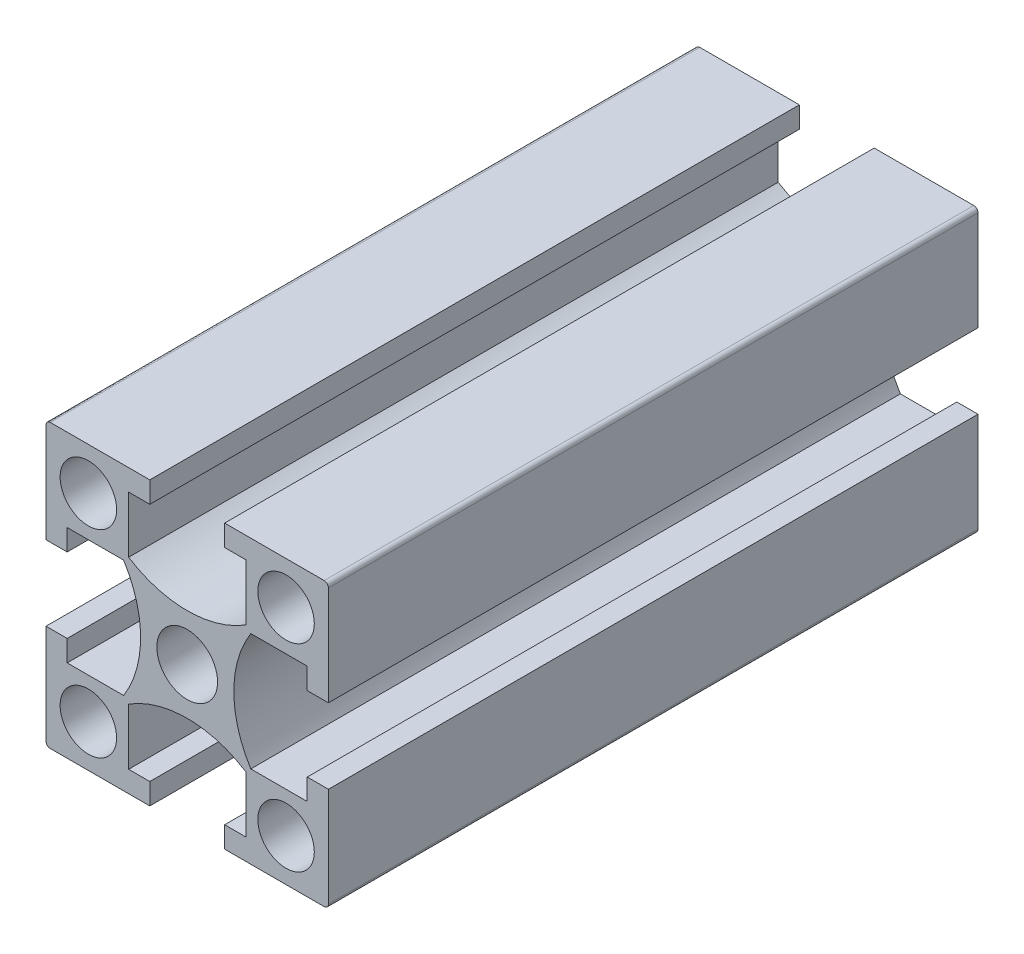
from build123d import *

# Parameters (mm, degrees)
SKETCH_1_W               = 20
SKETCH_1_H               = 20
SKETCH_1_R               = 2
SKETCH_1_R_2             = 2.15
EXTRUDE_1_DEPTH          = 46
CUT_EXTRUDE_1_REACH      = 50.125
PATTERN_CIRCULAR_1_COUNT = 4
FILLET_1_R               = 0.3
CUT_EXTRUDE_2_DEPTH      = 49.124837662
CUT_EXTRUDE_2_DEPTH_BACK = 49.124837662
SKETCH_2_R               = 2.5


with BuildPart() as part:
    # 스케치1 → 보스-돌출1 (new body)
    with BuildSketch(Plane.XY):
        Rectangle(SKETCH_1_W, SKETCH_1_H)
        with Locations((-7, -7)):
            Circle(SKETCH_1_R, mode=Mode.SUBTRACT)
        with Locations((7, -7)):
            Circle(SKETCH_1_R, mode=Mode.SUBTRACT)
        with Locations((-7, 7)):
            Circle(SKETCH_1_R, mode=Mode.SUBTRACT)
        Circle(SKETCH_1_R_2, mode=Mode.SUBTRACT)
        with Locations((7, 7)):
            Circle(SKETCH_1_R, mode=Mode.SUBTRACT)
    extrude(amount=EXTRUDE_1_DEPTH)

    # 스케치1<3> → 컷-돌출1 (cut, up to next)
    with BuildSketch(Plane.XY, mode=Mode.PRIVATE) as cut_extrude_1_sk1:
        with BuildLine():
            Line((-8.5, 2.65), (-10, 2.65))
            Line((-10, 2.65), (-10, -2.65))
            Line((-10, -2.65), (-8.5, -2.65))
            Line((-8.5, -2.65), (-8.5, -4.15))
            Line((-8.5, -4.15), (-4.503166667, -4.15))
            ThreePointArc((-4.503166667, -4.15), (-3.3, 0), (-4.503166667, 4.15))
            Line((-4.503166667, 4.15), (-8.5, 4.15))
            Line((-8.5, 4.15), (-8.5, 2.65))
        make_face()
    cut_extrude_1_tool1 = extrude(cut_extrude_1_sk1.sketch, amount=CUT_EXTRUDE_1_REACH, mode=Mode.PRIVATE) & part.part
    cut_extrude_1 = cut_extrude_1_tool1.solids().sort_by_distance((-6.606913, 0, 0))[0]
    add(cut_extrude_1, mode=Mode.SUBTRACT)

    # 원형 패턴1: 컷-돌출1 ×4 about axis
    pattern_circular_1_axis = Axis((0, 0, 46), (0, 0, -1))
    for i in range(1, PATTERN_CIRCULAR_1_COUNT):
        add(cut_extrude_1.rotate(pattern_circular_1_axis, i * 360 / PATTERN_CIRCULAR_1_COUNT), mode=Mode.SUBTRACT)

    # 필렛1
    fillet_1_edges = [part.edges().sort_by_distance(p)[0] for p in [
        (10, -10, 23),
        (-10, -10, 23),
        (-10, 10, 23),
        (10, 10, 23),
    ]]
    fillet(fillet_1_edges, radius=FILLET_1_R)

    # 스케치2 → 컷-돌출2 (cut, two sides: drawn at the far end of the back side and taken through both)
    with BuildSketch(Plane(origin=(0, 0, 0), x_dir=(0, 0, -1), z_dir=(1, 0, 0)).offset(-CUT_EXTRUDE_2_DEPTH_BACK)):
        with Locations((-8.5, 0)):
            Circle(SKETCH_2_R)
    extrude(amount=CUT_EXTRUDE_2_DEPTH + CUT_EXTRUDE_2_DEPTH_BACK, mode=Mode.SUBTRACT)


solid = part.part
